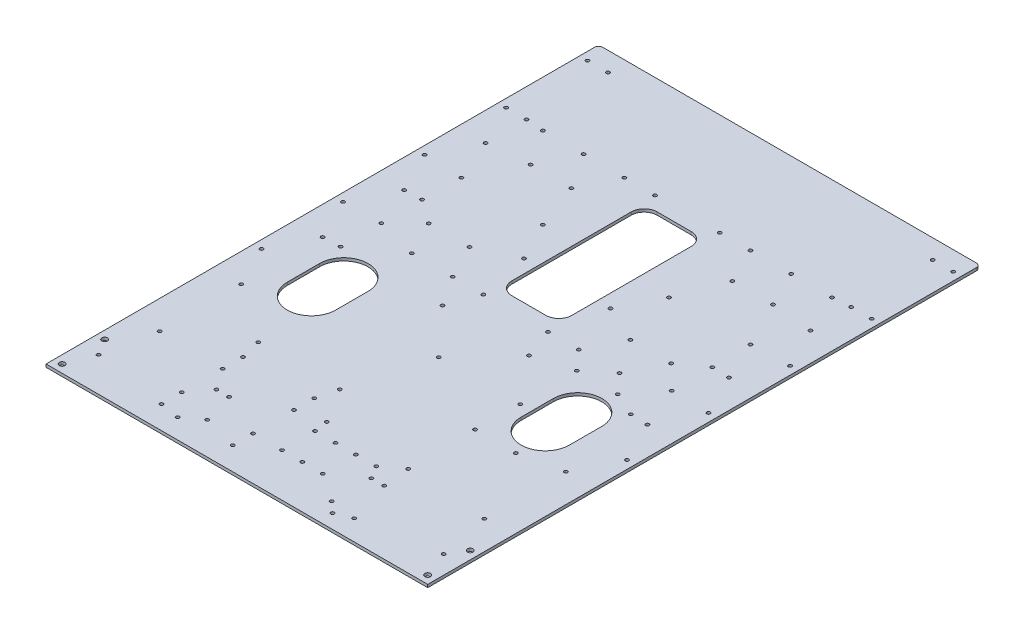
from build123d import *

# Parameters (mm, degrees)
SKETCH1_W               = 299.754
SKETCH1_H               = 435.61
BOSS_EXTRUDE1_DEPTH     = 2.286
SKETCH3_W               = 266.7
SKETCH3_H               = 2.286
BOSS_EXTRUDE2_DEPTH     = 15.24
FILLET1_R               = 5.08
SKETCH4_R               = 2.2225
SKETCH4_R_2             = 1.35255
SKETCH4_W               = 47.048
SKETCH4_H               = 114.064
CUT_EXTRUDE1_DEPTH      = 7.62
FILLET2_R               = 3.175
FILLET3_R               = 5.842
FILLET4_R               = 10.16
DELETEFACE1_START       = 211.074
DELETEFACE1_DEPTH       = 2.286
DELETEFACE1_START_2     = 211.759258716
DELETEFACE1_2_OUTLINE_W = 266.7
DELETEFACE1_2_OUTLINE_H = 2.286
DELETEFACE1_2_DEPTH     = 1.600741284
DELETEFACE1_START_3     = 209.55
DELETEFACE1_3_OUTLINE_W = 1.524
DELETEFACE1_3_OUTLINE_H = 2.286
DELETEFACE1_3_DEPTH     = 2.209258716
SKETCH5_W               = 245.406
SKETCH5_H               = 76.2
BOSS_EXTRUDE3_DEPTH     = 2.286


# Read off the part's stored shape, not the designer's step: DeleteFace1
with BuildPart() as part:
    # Sketch1 → Boss-Extrude1 (new body)
    with BuildSketch(Plane(origin=(0, 0, 0), x_dir=(1, 0, 0), z_dir=(0, 1, 0))):
        with Locations((0, 4.445)):
            Rectangle(SKETCH1_W, SKETCH1_H)
    extrude(amount=BOSS_EXTRUDE1_DEPTH)

    # Sketch3 → Boss-Extrude2 (add)
    with BuildSketch(Plane.XZ):
        with Locations((0, 212.217)):
            Rectangle(SKETCH3_W, SKETCH3_H)
    extrude(amount=-BOSS_EXTRUDE2_DEPTH)

    # Fillet1
    fillet1_edges = [part.edges().sort_by_distance(p)[0] for p in [
        (133.35, 15.24, 212.217),
        (-133.35, 15.24, 212.217),
    ]]
    fillet(fillet1_edges, radius=FILLET1_R)

    # Sketch4 → Cut-Extrude1 (cut)
    with BuildSketch(Plane(origin=(0, 0, 0), x_dir=(1, 0, 0), z_dir=(0, 1, 0))):
        with Locations(Location((143.527, -205.409258716, 0), (0, 0, 90))):
            Circle(SKETCH4_R)
        with Locations(Location((143.527, -172.008258716, 0), (0, 0, 90))):
            Circle(SKETCH4_R)
        with Locations(Location((127.528, -144.858258773, 0), (0, 0, 90))):
            Circle(SKETCH4_R_2)
        with Locations(Location((127.528, -80.858258887, 0), (0, 0, 90))):
            Circle(SKETCH4_R_2)
        with Locations(Location((127.528, -16.858259002, 0), (0, 0, 90))):
            Circle(SKETCH4_R_2)
        with Locations(Location((127.528, 47.14174157, 0), (0, 0, 90))):
            Circle(SKETCH4_R_2)
        with Locations(Location((127.528, 111.141741455, 0), (0, 0, 90))):
            Circle(SKETCH4_R_2)
        with Locations(Location((143.528, 79.141741512, 0), (0, 0, 90))):
            Circle(SKETCH4_R_2)
        with Locations(Location((143.528, 143.141741398, 0), (0, 0, 90))):
            Circle(SKETCH4_R_2)
        with Locations(Location((143.528, 207.141741284, 0), (0, 0, 90))):
            Circle(SKETCH4_R_2)
        with Locations(Location((127.528, 207.141741284, 0), (0, 0, 90))):
            Circle(SKETCH4_R_2)
        with Locations(Location((127.528, 143.141741398, 0), (0, 0, 90))):
            Circle(SKETCH4_R_2)
        with Locations(Location((143.528, 15.141741284, 0), (0, 0, 90))):
            Circle(SKETCH4_R_2)
        with Locations(Location((143.528, -48.858258945, 0), (0, 0, 90))):
            Circle(SKETCH4_R_2)
        with Locations(Location((-143.528, -48.858258945, 0), (0, 0, 90))):
            Circle(SKETCH4_R_2)
        with Locations(Location((-143.528, 15.141741284, 0), (0, 0, 90))):
            Circle(SKETCH4_R_2)
        with Locations(Location((-127.528, 143.141741398, 0), (0, 0, 90))):
            Circle(SKETCH4_R_2)
        with Locations(Location((-127.528, 207.141741284, 0), (0, 0, 90))):
            Circle(SKETCH4_R_2)
        with Locations(Location((-143.528, 207.141741284, 0), (0, 0, 90))):
            Circle(SKETCH4_R_2)
        with Locations(Location((-143.528, 143.141741398, 0), (0, 0, 90))):
            Circle(SKETCH4_R_2)
        with Locations(Location((-143.528, 79.141741512, 0), (0, 0, 90))):
            Circle(SKETCH4_R_2)
        with Locations(Location((-127.528, 111.141741455, 0), (0, 0, 90))):
            Circle(SKETCH4_R_2)
        with Locations(Location((-127.528, 47.14174157, 0), (0, 0, 90))):
            Circle(SKETCH4_R_2)
        with Locations(Location((-127.528, -16.858259002, 0), (0, 0, 90))):
            Circle(SKETCH4_R_2)
        with Locations(Location((-127.528, -80.858258887, 0), (0, 0, 90))):
            Circle(SKETCH4_R_2)
        with Locations(Location((-127.528, -144.858258773, 0), (0, 0, 90))):
            Circle(SKETCH4_R_2)
        with Locations(Location((-143.527, -172.008258716, 0), (0, 0, 90))):
            Circle(SKETCH4_R)
        with Locations(Location((-143.527, -205.409258716, 0), (0, 0, 90))):
            Circle(SKETCH4_R)
        with Locations(Location((-21.276, -193.710258716, 0), (0, 0, 90))):
            Circle(SKETCH4_R_2)
        with Locations(Location((-21.276, -177.710258716, 0), (0, 0, 90))):
            Circle(SKETCH4_R_2)
        with Locations(Location((-21.276, -145.710258716, 0), (0, 0, 90))):
            Circle(SKETCH4_R_2)
        with Locations(Location((-21.276, -129.710258716, 0), (0, 0, 90))):
            Circle(SKETCH4_R_2)
        with Locations(Location((-17.276, -113.710258716, 0), (0, 0, 90))):
            Circle(SKETCH4_R_2)
        with Locations(Location((-81.276, -113.710258716, 0), (0, 0, 90))):
            Circle(SKETCH4_R_2)
        with Locations(Location((-77.276, -129.710258716, 0), (0, 0, 90))):
            Circle(SKETCH4_R_2)
        with Locations(Location((-77.276, -145.710258716, 0), (0, 0, 90))):
            Circle(SKETCH4_R_2)
        with Locations(Location((-77.276, -177.710258716, 0), (0, 0, 90))):
            Circle(SKETCH4_R_2)
        with Locations(Location((-77.276, -193.710258716, 0), (0, 0, 90))):
            Circle(SKETCH4_R_2)
        with Locations(Location((-114.003, 47.68, 0), (0, 0, 90))):
            Circle(SKETCH4_R_2)
        with Locations(Location((-114.003, -16.32, 0), (0, 0, 90))):
            Circle(SKETCH4_R_2)
        with Locations(Location((-114.003, 15.68, 0), (0, 0, 90))):
            Circle(SKETCH4_R_2)
        with Locations(Location((-34.003, 47.68, 0), (0, 0, 90))):
            Circle(SKETCH4_R_2)
        with Locations(Location((-34.003, -16.32, 0), (0, 0, 90))):
            Circle(SKETCH4_R_2)
        with Locations(Location((114.004, 47.68, 0), (0, 0, 90))):
            Circle(SKETCH4_R_2)
        with Locations(Location((114.004, 15.68, 0), (0, 0, 90))):
            Circle(SKETCH4_R_2)
        with Locations(Location((114.004, -16.32, 0), (0, 0, 90))):
            Circle(SKETCH4_R_2)
        with Locations(Location((34.004, -16.32, 0), (0, 0, 90))):
            Circle(SKETCH4_R_2)
        with Locations(Location((34.004, 47.68, 0), (0, 0, 90))):
            Circle(SKETCH4_R_2)
        with Locations(Location((113.504, 78.05, 0), (0, 0, 90))):
            Circle(SKETCH4_R_2)
        with Locations(Location((49.504, 78.05, 0), (0, 0, 90))):
            Circle(SKETCH4_R_2)
        with Locations(Location((49.504, 142.05, 0), (0, 0, 90))):
            Circle(SKETCH4_R_2)
        with Locations(Location((113.504, 142.05, 0), (0, 0, 90))):
            Circle(SKETCH4_R_2)
        with Locations(Location((-113.503, 78.05, 0), (0, 0, 90))):
            Circle(SKETCH4_R_2)
        with Locations(Location((-113.503, 142.05, 0), (0, 0, 90))):
            Circle(SKETCH4_R_2)
        with Locations(Location((-49.503, 142.05, 0), (0, 0, 90))):
            Circle(SKETCH4_R_2)
        with Locations(Location((-49.503, 78.05, 0), (0, 0, 90))):
            Circle(SKETCH4_R_2)
        with Locations(Location((-0.276, -52.91983471, 0), (0, 0, 90))):
            Circle(SKETCH4_R_2)
        with Locations(Location((63.724495016, -52.91983471, 0), (0, 0, 90))):
            Circle(SKETCH4_R_2)
        with Locations(Location((-0.276, -140.92, 0), (0, 0, 90))):
            Circle(SKETCH4_R_2)
        with Locations(Location((63.724495016, -140.92, 0), (0, 0, 90))):
            Circle(SKETCH4_R_2)
        with Locations(Location((-25.4, 7.186, 0), (0, 0, 90))):
            Circle(SKETCH4_R_2)
        with Locations(Location((25.4, 7.186, 0), (0, 0, 90))):
            Circle(SKETCH4_R_2)
        with Locations(Location((-81.504, 7.186, 0), (0, 0, 90))):
            Circle(SKETCH4_R_2)
        with Locations(Location((-49.504, 7.186, 0), (0, 0, 90))):
            Circle(SKETCH4_R_2)
        with Locations(Location((49.503, 7.186, 0), (0, 0, 90))):
            Circle(SKETCH4_R_2)
        with Locations(Location((81.503, 7.186, 0), (0, 0, 90))):
            Circle(SKETCH4_R_2)
        with Locations(Location((-55.63, -162.234210769, 0), (0, 0, 90))):
            Circle(SKETCH4_R_2)
        with Locations(Location((-65.63, -162.234210769, 0), (0, 0, 90))):
            Circle(SKETCH4_R_2)
        with Locations(Location((-62, -196.234210769, 0), (0, 0, 90))):
            Circle(SKETCH4_R_2)
        with Locations(Location((-48.63, -186.484210769, 0), (0, 0, 90))):
            Circle(SKETCH4_R_2)
        with Locations(Location((55.63, -161.734210769, 0), (0, 0, 90))):
            Circle(SKETCH4_R_2)
        with Locations(Location((65.63, -161.734210769, 0), (0, 0, 90))):
            Circle(SKETCH4_R_2)
        with Locations(Location((64.050252532, -200.683958237, 0), (0, 0, 90))):
            Circle(SKETCH4_R_2)
        with Locations(Location((76, -195.734210769, 0), (0, 0, 90))):
            Circle(SKETCH4_R_2)
        with Locations(Location((55.63, -192.984210769, 0), (0, 0, 90))):
            Circle(SKETCH4_R_2)
        with Locations(Location((135.528, -184.858258716, 0), (0, 0, 90))):
            Circle(SKETCH4_R_2)
        with Locations(Location((-135.527, -184.858258716, 0), (0, 0, 90))):
            Circle(SKETCH4_R_2)
        with Locations(Location((63.18, -87.871446764, 0), (0, 0, 90))):
            Circle(SKETCH4_R_2)
        with Locations(Location((95.18, -87.871446764, 0), (0, 0, 90))):
            Circle(SKETCH4_R_2)
        with Locations(Location((63.18, -7.871446764, 0), (0, 0, 90))):
            Circle(SKETCH4_R_2)
        with Locations(Location((95.18, -7.871446764, 0), (0, 0, 90))):
            Circle(SKETCH4_R_2)
        with Locations(Location((63.18, 34.1, 0), (0, 0, 90))):
            Circle(SKETCH4_R_2)
        with Locations(Location((95.18, 34.1, 0), (0, 0, 90))):
            Circle(SKETCH4_R_2)
        with Locations(Location((63.18, 114.1, 0), (0, 0, 90))):
            Circle(SKETCH4_R_2)
        with Locations(Location((95.18, 114.1, 0), (0, 0, 90))):
            Circle(SKETCH4_R_2)
        with Locations(Location((-95.18, 34.1, 0), (0, 0, 90))):
            Circle(SKETCH4_R_2)
        with Locations(Location((-63.18, 34.1, 0), (0, 0, 90))):
            Circle(SKETCH4_R_2)
        with Locations(Location((-95.18, 114.1, 0), (0, 0, 90))):
            Circle(SKETCH4_R_2)
        with Locations(Location((-63.18, 114.1, 0), (0, 0, 90))):
            Circle(SKETCH4_R_2)
        with Locations(Location((-81.503, 142.05, 0), (0, 0, 90))):
            Circle(SKETCH4_R_2)
        with Locations(Location((-25.4, 142.05, 0), (0, 0, 90))):
            Circle(SKETCH4_R_2)
        with Locations(Location((25.4, 142.05, 0), (0, 0, 90))):
            Circle(SKETCH4_R_2)
        with Locations(Location((81.504, 142.05, 0), (0, 0, 90))):
            Circle(SKETCH4_R_2)
        with Locations(Location((1.4, -177.710258716, 0), (0, 0, 90))):
            Circle(SKETCH4_R_2)
        with Locations(Location((17.4, -177.710258716, 0), (0, 0, 90))):
            Circle(SKETCH4_R_2)
        with Locations(Location((33.4, -177.710258716, 0), (0, 0, 90))):
            Circle(SKETCH4_R_2)
        with Locations(Location((1.4, -151.710258716, 0), (0, 0, 90))):
            Circle(SKETCH4_R_2)
        with Locations(Location((33.4, -151.710258716, 0), (0, 0, 90))):
            Circle(SKETCH4_R_2)
        with Locations(Location((17.4, -151.710258716, 0), (0, 0, 90))):
            Circle(SKETCH4_R_2)
        with Locations(Location((49.4, -151.710258716, 0), (0, 0, 90))):
            Circle(SKETCH4_R_2)
        Polygon((119.528, 227.33), (119.528, 190.5), (67.597, 190.5), (67.597, 146.05), (-67.597, 146.05), (-67.597, 190.5), (-119.528, 190.5), (-119.528, 227.33), align=None)
        with Locations((0, 74.618)):
            Rectangle(SKETCH4_W, SKETCH4_H)
        with BuildLine():
            Line((-110.803, -61.358258716), (-110.803, -35.958258716))
            ThreePointArc((-110.803, -35.958258716), (-91.803, -16.958258716), (-72.803, -35.958258716))
            Line((-72.803, -35.958258716), (-72.803, -61.358258716))
            ThreePointArc((-72.803, -61.358258716), (-91.803, -80.358258716), (-110.803, -61.358258716))
        make_face()
        with BuildLine():
            Line((110.803, -61.358258716), (110.803, -35.958258716))
            ThreePointArc((110.803, -35.958258716), (91.803, -16.958258716), (72.803, -35.958258716))
            Line((72.803, -35.958258716), (72.803, -61.358258716))
            ThreePointArc((72.803, -61.358258716), (91.803, -80.358258716), (110.803, -61.358258716))
        make_face()
        Polygon((149.877, -213.36), (133.35, -213.36), (133.35, -209.55), (134.874, -209.55), (134.874, -211.759258716), (149.877, -211.759258716), align=None)
        Polygon((-149.877, -213.36), (-133.35, -213.36), (-133.35, -209.55), (-134.874, -209.55), (-134.874, -211.759258716), (-149.877, -211.759258716), align=None)
    extrude(amount=CUT_EXTRUDE1_DEPTH, mode=Mode.SUBTRACT)

    # Fillet2
    fillet2_edges = [part.edges().sort_by_distance(p)[0] for p in [
        (-119.528, 1.143, -222.25),
        (119.528, 1.143, -222.25),
        (-149.877, 1.143, -222.25),
        (149.877, 1.143, -222.25),
    ]]
    fillet(fillet2_edges, radius=FILLET2_R)

    # Fillet3
    fillet3_edges = [part.edges().sort_by_distance(p)[0] for p in [
        (119.528, 1.143, -190.5),
        (-119.528, 1.143, -190.5),
        (-67.597, 1.143, -190.5),
        (-67.597, 1.143, -146.05),
        (67.597, 1.143, -146.05),
        (67.597, 1.143, -190.5),
    ]]
    fillet(fillet3_edges, radius=FILLET3_R)

    # Fillet4
    fillet4_edges = [part.edges().sort_by_distance(p)[0] for p in [
        (-23.524, 1.143, -131.65),
        (-23.524, 1.143, -17.586),
        (23.524, 1.143, -17.586),
        (23.524, 1.143, -131.65),
    ]]
    fillet(fillet4_edges, radius=FILLET4_R)

    # DeleteFace1 outline → DeleteFace1 (cut)
    with BuildSketch(Plane.XY.offset(DELETEFACE1_START)):
        with BuildLine():
            Line((-133.35, 2.286), (133.35, 2.286))
            Line((133.35, 2.286), (133.35, 10.16))
            ThreePointArc((133.35, 10.16), (131.862102448, 13.752102448), (128.27, 15.24))
            Line((128.27, 15.24), (-128.27, 15.24))
            ThreePointArc((-128.27, 15.24), (-131.862102448, 13.752102448), (-133.35, 10.16))
            Line((-133.35, 10.16), (-133.35, 2.286))
        make_face()
    extrude(amount=DELETEFACE1_DEPTH, mode=Mode.SUBTRACT)

    # DeleteFace1 2 outline → DeleteFace1 2 (cut)
    with BuildSketch(Plane.XY.offset(DELETEFACE1_START_2)):
        with Locations((0, 1.143)):
            Rectangle(DELETEFACE1_2_OUTLINE_W, DELETEFACE1_2_OUTLINE_H)
    extrude(amount=DELETEFACE1_2_DEPTH, mode=Mode.SUBTRACT)

    # DeleteFace1 3 outline → DeleteFace1 3 (add)
    with BuildSketch(Plane.XY.offset(DELETEFACE1_START_3)):
        with Locations((134.112, 1.143)):
            Rectangle(DELETEFACE1_3_OUTLINE_W, DELETEFACE1_3_OUTLINE_H)
        with Locations((-134.112, 1.143)):
            Rectangle(DELETEFACE1_3_OUTLINE_W, DELETEFACE1_3_OUTLINE_H)
    extrude(amount=DELETEFACE1_3_DEPTH)

    # Sketch5 → Boss-Extrude3 (add)
    with BuildSketch(Plane(origin=(0, 2.286, 0), x_dir=(1, 0, 0), z_dir=(0, 1, 0))):
        with Locations((0, 184.15)):
            Rectangle(SKETCH5_W, SKETCH5_H)
    extrude(amount=-BOSS_EXTRUDE3_DEPTH)


solid = part.part
